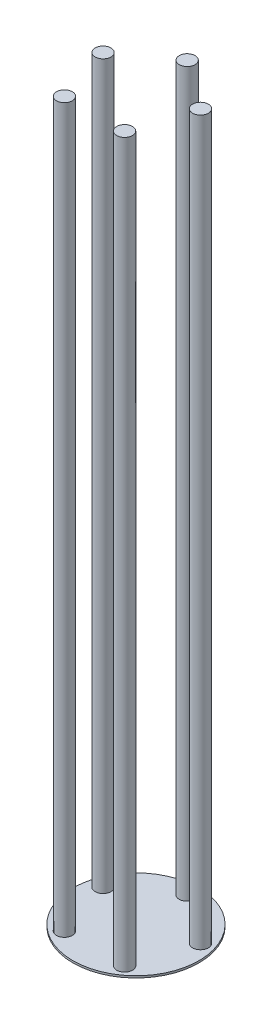
from build123d import *

# Parameters (mm, degrees)
SKETCH1_R             = 101.6
BOSS_EXTRUDE1_DEPTH   = 3.175
SKETCH2_R             = 12.827
CUT_EXTRUDE2_DEPTH    = 3.175
SKETCH3_R             = 12.7
BOSS_EXTRUDE3_DEPTH   = 1168.4
BOSS_EXTRUDE3_2_DEPTH = 1168.4
BOSS_EXTRUDE3_3_DEPTH = 1168.4
BOSS_EXTRUDE3_4_DEPTH = 1168.4
BOSS_EXTRUDE3_5_DEPTH = 1168.4


with BuildPart() as part:
    # Sketch1 → Boss-Extrude1 (new body)
    with BuildSketch(Plane(origin=(0, 0, 0), x_dir=(1, 0, 0), z_dir=(0, 1, 0))):
        Circle(SKETCH1_R)
    extrude(amount=BOSS_EXTRUDE1_DEPTH)

    # Sketch2 → Cut-Extrude2 (cut)
    with BuildSketch(Plane(origin=(0, 3.175, 0), x_dir=(1, 0, 0), z_dir=(0, 1, 0))):
        with Locations((0, 82.55)):
            Circle(SKETCH2_R)
        with Locations((78.50971542, 25.509352886)):
            Circle(SKETCH2_R)
        with Locations((48.521672577, -66.784352886)):
            Circle(SKETCH2_R)
        with Locations((-48.521672577, -66.784352886)):
            Circle(SKETCH2_R)
        with Locations((-78.50971542, 25.509352886)):
            Circle(SKETCH2_R)
    extrude(amount=-CUT_EXTRUDE2_DEPTH, mode=Mode.SUBTRACT)


with BuildPart() as body_2:
    # Sketch3 → Boss-Extrude3 (new body)
    with BuildSketch(Plane(origin=(0, 0, 0), x_dir=(1, 0, 0), z_dir=(0, 1, 0))):
        with Locations((0, 82.55)):
            Circle(SKETCH3_R)
    extrude(amount=BOSS_EXTRUDE3_DEPTH)


with BuildPart() as body_3:
    # Sketch3 → Boss-Extrude3 2 (new body)
    with BuildSketch(Plane(origin=(0, 0, 0), x_dir=(1, 0, 0), z_dir=(0, 1, 0))):
        with Locations((78.50971542, 25.509352886)):
            Circle(SKETCH3_R)
    extrude(amount=BOSS_EXTRUDE3_2_DEPTH)


with BuildPart() as body_4:
    # Sketch3 → Boss-Extrude3 3 (new body)
    with BuildSketch(Plane(origin=(0, 0, 0), x_dir=(1, 0, 0), z_dir=(0, 1, 0))):
        with Locations((48.521672577, -66.784352886)):
            Circle(SKETCH3_R)
    extrude(amount=BOSS_EXTRUDE3_3_DEPTH)


with BuildPart() as body_5:
    # Sketch3 → Boss-Extrude3 4 (new body)
    with BuildSketch(Plane(origin=(0, 0, 0), x_dir=(1, 0, 0), z_dir=(0, 1, 0))):
        with Locations((-48.521672577, -66.784352886)):
            Circle(SKETCH3_R)
    extrude(amount=BOSS_EXTRUDE3_4_DEPTH)


with BuildPart() as body_6:
    # Sketch3 → Boss-Extrude3 5 (new body)
    with BuildSketch(Plane(origin=(0, 0, 0), x_dir=(1, 0, 0), z_dir=(0, 1, 0))):
        with Locations((-78.50971542, 25.509352886)):
            Circle(SKETCH3_R)
    extrude(amount=BOSS_EXTRUDE3_5_DEPTH)


solid = Compound([part.part, body_2.part, body_3.part, body_4.part, body_5.part, body_6.part])
